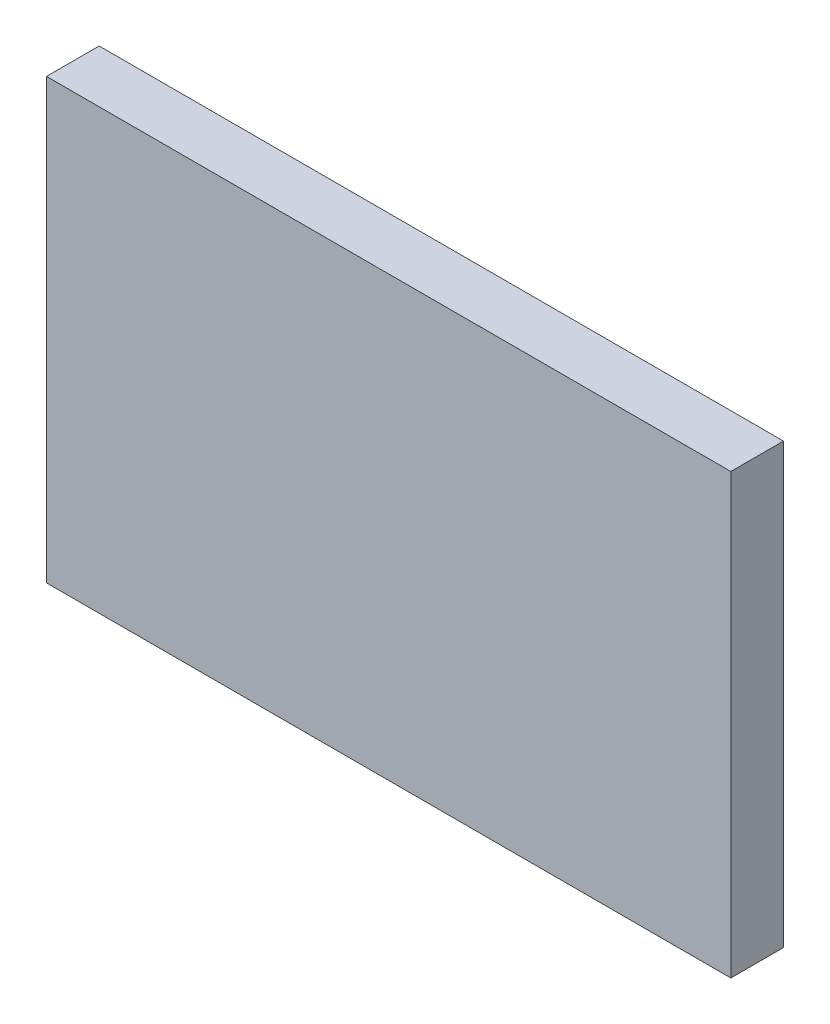
from build123d import *

# Parameters (mm, degrees)
SKETCH1_W           = 390
SKETCH1_H           = 250
BOSS_EXTRUDE1_DEPTH = 30


with BuildPart() as part:
    # Sketch1 → Boss-Extrude1 (new body)
    with BuildSketch(Plane.XY):
        Rectangle(SKETCH1_W, SKETCH1_H)
    extrude(amount=BOSS_EXTRUDE1_DEPTH)


solid = part.part
